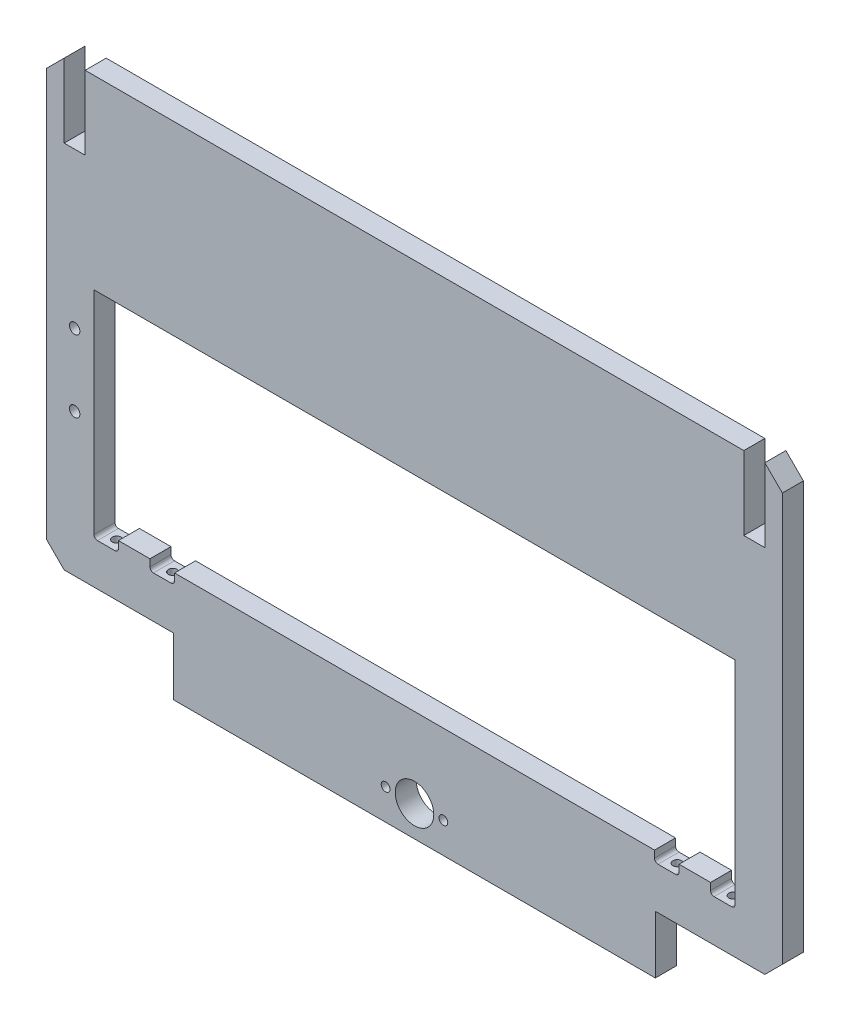
from build123d import *

# Parameters (mm, degrees)
SKETCH1_W            = 275
SKETCH1_H            = 33
BOSS_EXTRUDE1_DEPTH  = 12
CUT_EXTRUDE1_REACH   = 141.005
SKETCH2_R            = 11
SKETCH2_R_2          = 2.5
SKETCH3_W            = 366
SKETCH3_H            = 117
BOSS_EXTRUDE2_DEPTH  = 12
CUT_EXTRUDE2_REACH   = 308.55
SKETCH4_R            = 2.5
CUT_EXTRUDE3_REACH   = 343.869
SKETCH5_W            = 14
SKETCH5_H            = 6
FILLET1_R            = 2
FILLET1_OF_MIRROR2_R = 2
CHAMFER1_SIZE        = 10
CUT_EXTRUDE4_REACH   = 343.869
SKETCH6_R            = 3
CUT_EXTRUDE6_REACH   = 343.869
SKETCH8_W            = 12
SKETCH8_H            = 42
CHAMFER2_SIZE        = 10


with BuildPart() as part:
    # Sketch1 → Boss-Extrude1 (new body)
    with BuildSketch(Plane.XY):
        Rectangle(SKETCH1_W, SKETCH1_H)
    extrude(amount=BOSS_EXTRUDE1_DEPTH)

    # Sketch2 → Cut-Extrude1 (cut, up to next)
    with BuildSketch(Plane.XY.offset(12), mode=Mode.PRIVATE) as cut_extrude1_sk1:
        with Locations((0, 1)):
            Circle(SKETCH2_R)
    cut_extrude1_tool1 = extrude(cut_extrude1_sk1.sketch, amount=-CUT_EXTRUDE1_REACH, mode=Mode.PRIVATE) & part.part
    # Sketch2 → Cut-Extrude1 (cut, up to next)
    with BuildSketch(Plane.XY.offset(12), mode=Mode.PRIVATE) as cut_extrude1_sk2:
        with Locations((-16.5, 1)):
            Circle(SKETCH2_R_2)
    cut_extrude1_tool2 = extrude(cut_extrude1_sk2.sketch, amount=-CUT_EXTRUDE1_REACH, mode=Mode.PRIVATE) & part.part
    # Sketch2 → Cut-Extrude1 (cut, up to next)
    with BuildSketch(Plane.XY.offset(12), mode=Mode.PRIVATE) as cut_extrude1_sk3:
        with Locations((16.5, 1)):
            Circle(SKETCH2_R_2)
    cut_extrude1_tool3 = extrude(cut_extrude1_sk3.sketch, amount=-CUT_EXTRUDE1_REACH, mode=Mode.PRIVATE) & part.part
    add(cut_extrude1_tool1.solids().sort_by_distance((0, 1, 12))[0], mode=Mode.SUBTRACT)
    add(cut_extrude1_tool2.solids().sort_by_distance((-16.5, 1, 12))[0], mode=Mode.SUBTRACT)
    add(cut_extrude1_tool3.solids().sort_by_distance((16.5, 1, 12))[0], mode=Mode.SUBTRACT)

    # Sketch3 → Boss-Extrude2 (add)
    with BuildSketch(Plane.XY.offset(12)):
        Polygon((-210, 16.5), (210, 16.5), (210, 46.5), (210, 269.5), (-210, 269.5), (-210, 46.5), align=None)
        with Locations((0, 105)):
            Rectangle(SKETCH3_W, SKETCH3_H, mode=Mode.SUBTRACT)
    extrude(amount=-BOSS_EXTRUDE2_DEPTH)

    # Sketch4 → Cut-Extrude2 (cut, up to next)
    with BuildSketch(Plane(origin=(0, 46.5, 0), x_dir=(1, 0, 0), z_dir=(0, 1, 0)), mode=Mode.PRIVATE) as cut_extrude2_sk1:
        with Locations(Location((-144, -6, 0), (0, 0, 270))):
            Circle(SKETCH4_R)
    cut_extrude2_tool1 = extrude(cut_extrude2_sk1.sketch, amount=-CUT_EXTRUDE2_REACH, mode=Mode.PRIVATE) & part.part
    # Sketch4 → Cut-Extrude2 (cut, up to next)
    with BuildSketch(Plane(origin=(0, 46.5, 0), x_dir=(1, 0, 0), z_dir=(0, 1, 0)), mode=Mode.PRIVATE) as cut_extrude2_sk2:
        with Locations(Location((-176, -6, 0), (0, 0, 270))):
            Circle(SKETCH4_R)
    cut_extrude2_tool2 = extrude(cut_extrude2_sk2.sketch, amount=-CUT_EXTRUDE2_REACH, mode=Mode.PRIVATE) & part.part
    cut_extrude2_1 = cut_extrude2_tool1.solids().sort_by_distance((-144, 46.5, 6))[0]
    add(cut_extrude2_1, mode=Mode.SUBTRACT)
    cut_extrude2_2 = cut_extrude2_tool2.solids().sort_by_distance((-176, 46.5, 6))[0]
    add(cut_extrude2_2, mode=Mode.SUBTRACT)
    cut_extrude2 = cut_extrude2_1 + cut_extrude2_2  # Cut-Extrude2 as one shape, for the pattern or mirror that repeats it

    # Mirror1: Cut-Extrude2 across plane
    add(cut_extrude2.mirror(Plane(origin=(0, 0, 0), x_dir=(0, 0, 1), z_dir=(1, 0, 0))), mode=Mode.SUBTRACT)

    # Sketch5 → Cut-Extrude3 (cut, up to next)
    with BuildSketch(Plane.XY.offset(12), mode=Mode.PRIVATE) as cut_extrude3_sk1:
        with Locations((-176, 43.5)):
            Rectangle(SKETCH5_W, SKETCH5_H)
    cut_extrude3_tool1 = extrude(cut_extrude3_sk1.sketch, amount=-CUT_EXTRUDE3_REACH, mode=Mode.PRIVATE) & part.part
    # Sketch5 → Cut-Extrude3 (cut, up to next)
    with BuildSketch(Plane.XY.offset(12), mode=Mode.PRIVATE) as cut_extrude3_sk2:
        with Locations((-144, 43.5)):
            Rectangle(SKETCH5_W, SKETCH5_H)
    cut_extrude3_tool2 = extrude(cut_extrude3_sk2.sketch, amount=-CUT_EXTRUDE3_REACH, mode=Mode.PRIVATE) & part.part
    cut_extrude3_1 = cut_extrude3_tool1.solids().sort_by_distance((-176, 43.5, 12))[0]
    add(cut_extrude3_1, mode=Mode.SUBTRACT)
    cut_extrude3_2 = cut_extrude3_tool2.solids().sort_by_distance((-144, 43.5, 12))[0]
    add(cut_extrude3_2, mode=Mode.SUBTRACT)
    cut_extrude3 = cut_extrude3_1 + cut_extrude3_2  # Cut-Extrude3 as one shape, for the pattern or mirror that repeats it

    # Fillet1
    fillet1_edges = [part.edges().sort_by_distance(p)[0] for p in [
        (-169, 40.5, 6),
        (-183, 40.5, 6),
        (-137, 40.5, 6),
        (-151, 40.5, 6),
    ]]
    fillet(fillet1_edges, radius=FILLET1_R)

    # Mirror2: Cut-Extrude3 across plane
    add(cut_extrude3.mirror(Plane(origin=(0, 0, 0), x_dir=(0, 0, 1), z_dir=(1, 0, 0))), mode=Mode.SUBTRACT)

    # Fillet1 of Mirror2
    fillet1_of_mirror2_edges = [part.edges().sort_by_distance(p)[0] for p in [
        (169, 40.5, 6),
        (183, 40.5, 6),
        (137, 40.5, 6),
        (151, 40.5, 6),
    ]]
    fillet(fillet1_of_mirror2_edges, radius=FILLET1_OF_MIRROR2_R)

    # Chamfer1
    chamfer1_edges = [part.edges().sort_by_distance(p)[0] for p in [
        (210, 16.5, 6),
        (-210, 16.5, 6),
    ]]
    chamfer(chamfer1_edges, length=CHAMFER1_SIZE)

    # Sketch6 → Cut-Extrude4 (cut, up to next)
    with BuildSketch(Plane.XY.offset(12), mode=Mode.PRIVATE) as cut_extrude4_sk1:
        with Locations((-194, 138.905602013)):
            Circle(SKETCH6_R)
    cut_extrude4_tool1 = extrude(cut_extrude4_sk1.sketch, amount=-CUT_EXTRUDE4_REACH, mode=Mode.PRIVATE) & part.part
    # Sketch6 → Cut-Extrude4 (cut, up to next)
    with BuildSketch(Plane.XY.offset(12), mode=Mode.PRIVATE) as cut_extrude4_sk2:
        with Locations((-194, 97.894768826)):
            Circle(SKETCH6_R)
    cut_extrude4_tool2 = extrude(cut_extrude4_sk2.sketch, amount=-CUT_EXTRUDE4_REACH, mode=Mode.PRIVATE) & part.part
    add(cut_extrude4_tool1.solids().sort_by_distance((-194, 138.905602, 12))[0], mode=Mode.SUBTRACT)
    add(cut_extrude4_tool2.solids().sort_by_distance((-194, 97.894769, 12))[0], mode=Mode.SUBTRACT)

    # Sketch8 → Cut-Extrude6 (cut, up to next)
    with BuildSketch(Plane.XY.offset(12), mode=Mode.PRIVATE) as cut_extrude6_sk1:
        with Locations((-194, 248.5)):
            Rectangle(SKETCH8_W, SKETCH8_H)
    cut_extrude6_tool1 = extrude(cut_extrude6_sk1.sketch, amount=-CUT_EXTRUDE6_REACH, mode=Mode.PRIVATE) & part.part
    # Sketch8 → Cut-Extrude6 (cut, up to next)
    with BuildSketch(Plane.XY.offset(12), mode=Mode.PRIVATE) as cut_extrude6_sk2:
        with Locations((194, 248.5)):
            Rectangle(SKETCH8_W, SKETCH8_H)
    cut_extrude6_tool2 = extrude(cut_extrude6_sk2.sketch, amount=-CUT_EXTRUDE6_REACH, mode=Mode.PRIVATE) & part.part
    add(cut_extrude6_tool1.solids().sort_by_distance((-194, 248.5, 12))[0], mode=Mode.SUBTRACT)
    add(cut_extrude6_tool2.solids().sort_by_distance((194, 248.5, 12))[0], mode=Mode.SUBTRACT)

    # Chamfer2
    chamfer2_edges = [part.edges().sort_by_distance(p)[0] for p in [
        (210, 269.5, 6),
        (-210, 269.5, 6),
    ]]
    chamfer(chamfer2_edges, length=CHAMFER2_SIZE - 0.0001)  # a hair under: the kernel refuses the full size


solid = part.part
